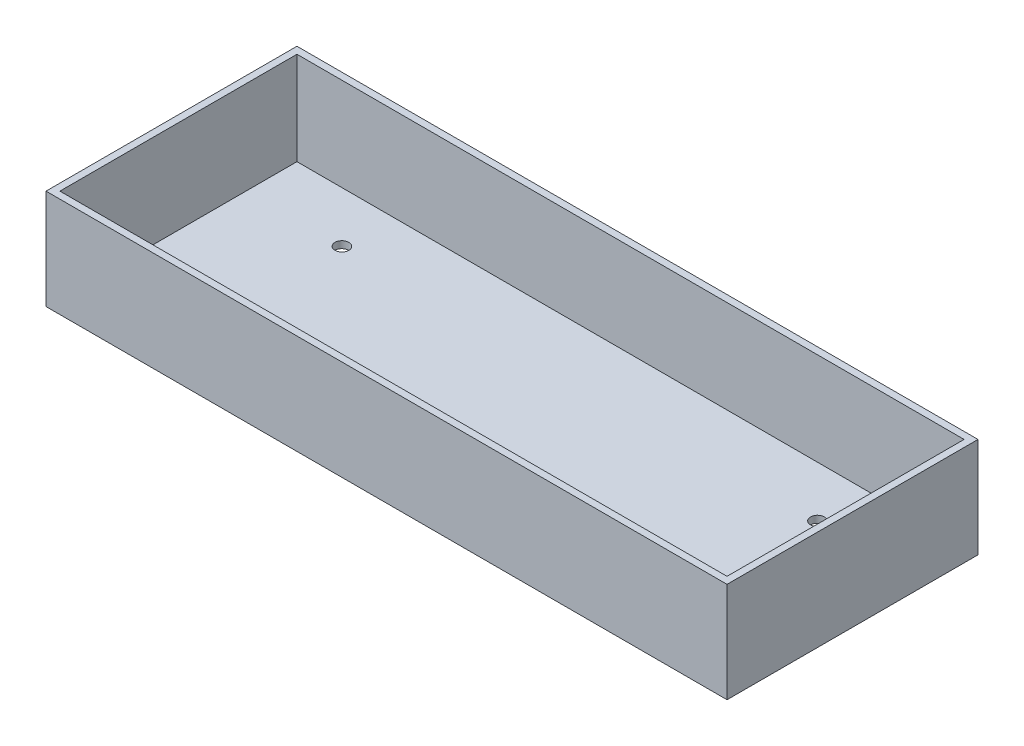
from build123d import *

# Parameters (mm, degrees)
ESQUISSE1_W        = 196.2
ESQUISSE1_H        = 72.3
ESQUISSE1_W_2      = 192.2
ESQUISSE1_H_2      = 68.3
BOSS_EXTRU_1_DEPTH = 28.8
ESQUISSE1_3_W      = 192.2
ESQUISSE1_3_H      = 68.3
ESQUISSE1_3_R      = 2
BOSS_EXTRU_2_DEPTH = 2


with BuildPart() as part:
    # Esquisse1 → Boss.-Extru.1 (new body)
    with BuildSketch(Plane(origin=(0, 0, 0), x_dir=(1, 0, 0), z_dir=(0, 1, 0))):
        with Locations((98.1, 36.15)):
            Rectangle(ESQUISSE1_W, ESQUISSE1_H)
        with Locations((98.1, 36.15)):
            Rectangle(ESQUISSE1_W_2, ESQUISSE1_H_2, mode=Mode.SUBTRACT)
    extrude(amount=BOSS_EXTRU_1_DEPTH)

    # Esquisse1<3> → Boss.-Extru.2 (add)
    with BuildSketch(Plane(origin=(0, 0, 0), x_dir=(1, 0, 0), z_dir=(0, 1, 0))):
        with Locations((98.1, 36.15)):
            Rectangle(ESQUISSE1_3_W, ESQUISSE1_3_H)
        with Locations((29.6, 55.65)):
            Circle(ESQUISSE1_3_R, mode=Mode.SUBTRACT)
        with Locations((29.6, 16.65)):
            Circle(ESQUISSE1_3_R, mode=Mode.SUBTRACT)
        with Locations((166.6, 55.65)):
            Circle(ESQUISSE1_3_R, mode=Mode.SUBTRACT)
        with Locations((166.6, 16.65)):
            Circle(ESQUISSE1_3_R, mode=Mode.SUBTRACT)
    extrude(amount=BOSS_EXTRU_2_DEPTH)


solid = part.part
